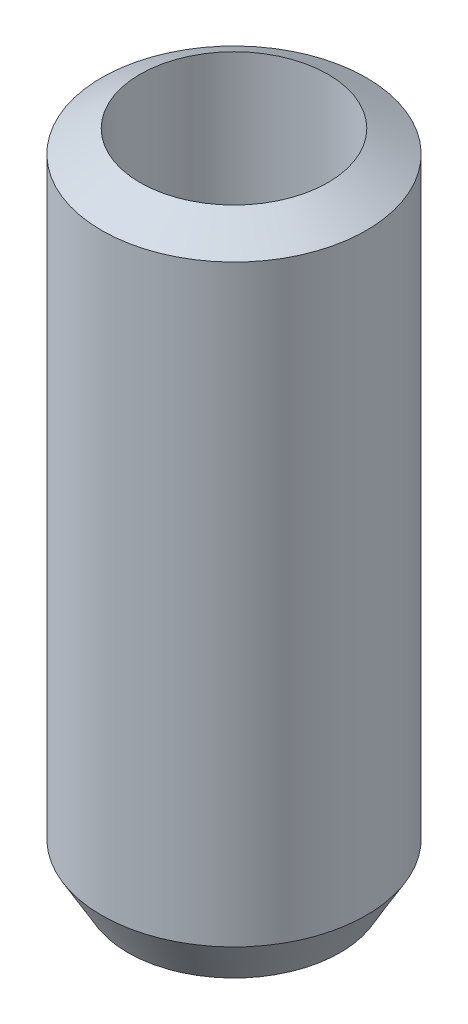
from build123d import *

# Parameters (mm, degrees)
SKETCH1_R           = 17.5
BOSS_EXTRUDE1_DEPTH = 87.908132
SKETCH2_R           = 12.41877506
CUT_EXTRUDE1_DEPTH  = 92.325460151
CHAMFER1_SIZE       = 3.469882
CHAMFER1_SIZE_2     = 6.010011


with BuildPart() as part:
    # Sketch1 → Boss-Extrude1 (new body)
    with BuildSketch(Plane(origin=(0, 0, 0), x_dir=(1, 0, 0), z_dir=(0, 1, 0))):
        with Locations(Location((0, 0, 0), (0, 0, 270))):
            Circle(SKETCH1_R)
    extrude(amount=BOSS_EXTRUDE1_DEPTH)

    # Sketch2 → Cut-Extrude1 (cut, through all)
    with BuildSketch(Plane(origin=(0, 0, 0), x_dir=(1, 0, 0), z_dir=(0, 1, 0))):
        with Locations(Location((0, 0, 0), (0, 0, 270))):
            Circle(SKETCH2_R)
    extrude(amount=CUT_EXTRUDE1_DEPTH, mode=Mode.SUBTRACT)

    # Chamfer1
    # the kernel refuses this chamfer: 6.010011, 3.469882 mm, written as the material it takes off along each edge
    with BuildSketch(Plane(origin=(0, 87.908132, 0), x_dir=(0, 0, 1), z_dir=(-1, 0, 0))) as chamfer1_piece_1:
        Polygon((17.5, -CHAMFER1_SIZE), (17.5 - CHAMFER1_SIZE_2, 0), (17.5, 0), align=None)
    revolve(axis=Axis((0, 87.908132, 0), (0, 1, 0)), mode=Mode.SUBTRACT)
    with BuildSketch(Plane(origin=(0, 0, 0), x_dir=(0, 0, 1), z_dir=(-1, 0, 0))) as chamfer1_piece_2:
        Polygon((17.5, CHAMFER1_SIZE_2), (17.5 - CHAMFER1_SIZE, 0), (17.5, 0), align=None)
    revolve(axis=Axis((0, 0, 0), (0, 1, 0)), mode=Mode.SUBTRACT)


solid = part.part
